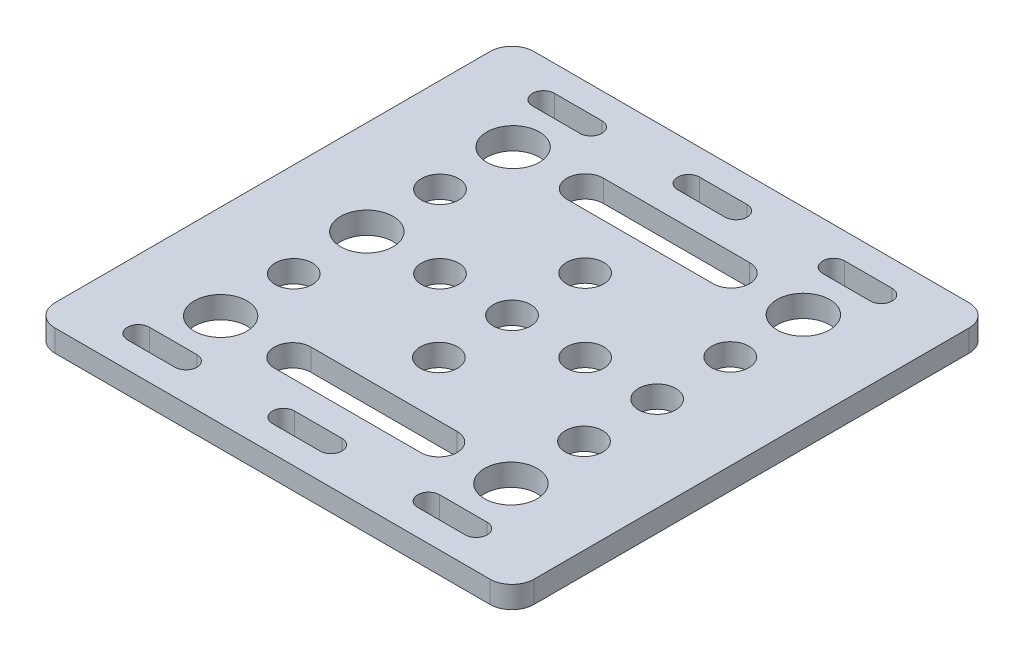
from build123d import *

# Parameters (mm, degrees)
SZKIC1_R                        = 2.55
SZKIC1_R_2                      = 3.6
DODANIE_WYCI_GNI_CIE1_DEPTH     = 3
OTWORY_USTALAJ_CE_10_0MM1_D     = 7.2
OTWORY_USTALAJ_CE_10_0MM1_DEPTH = 11.5
OTWORY_USTALAJ_CE_10_0MM1_TIP   = 2.163098228


with BuildPart() as part:
    # Szkic1 → Dodanie-wyciągnięcie1 (new body)
    with BuildSketch(Plane(origin=(0, 0, 0), x_dir=(1, 0, 0), z_dir=(0, 1, 0))):
        with BuildLine():
            ThreePointArc((0, 3), (0.878679656, 0.878679656), (3, 0))
            Line((3, 0), (62.5, 0))
            ThreePointArc((62.5, 0), (64.621320344, 0.878679656), (65.5, 3))
            Line((65.5, 3), (65.5, 62.5))
            ThreePointArc((65.5, 62.5), (64.621320344, 64.621320344), (62.5, 65.5))
            Line((62.5, 65.5), (3, 65.5))
            ThreePointArc((3, 65.5), (0.878679656, 64.621320344), (0, 62.5))
            Line((0, 62.5), (0, 3))
        make_face()
        with BuildLine():
            Line((15.85, 3.55), (9.35, 3.55))
            ThreePointArc((9.35, 3.55), (7.85, 5.05), (9.35, 6.55))
            Line((9.35, 6.55), (15.85, 6.55))
            ThreePointArc((15.85, 6.55), (17.35, 5.05), (15.85, 3.55))
        make_face(mode=Mode.SUBTRACT)
        with BuildLine():
            Line((35.7, 3.55), (29.2, 3.55))
            ThreePointArc((29.2, 3.55), (27.7, 5.05), (29.2, 6.55))
            Line((29.2, 6.55), (35.7, 6.55))
            ThreePointArc((35.7, 6.55), (37.2, 5.05), (35.7, 3.55))
        make_face(mode=Mode.SUBTRACT)
        with Locations((12.9, 22.75)):
            Circle(SZKIC1_R, mode=Mode.SUBTRACT)
        with Locations((22.9, 32.75)):
            Circle(SZKIC1_R, mode=Mode.SUBTRACT)
        with BuildLine():
            ThreePointArc((22.75, 10.25), (20.25, 12.75), (22.75, 15.25))
            Line((22.75, 15.25), (42.75, 15.25))
            ThreePointArc((42.75, 15.25), (45.25, 12.75), (42.75, 10.25))
            Line((42.75, 10.25), (22.75, 10.25))
        make_face(mode=Mode.SUBTRACT)
        with BuildLine():
            Line((55.55, 3.55), (49.05, 3.55))
            ThreePointArc((49.05, 3.55), (47.55, 5.05), (49.05, 6.55))
            Line((49.05, 6.55), (55.55, 6.55))
            ThreePointArc((55.55, 6.55), (57.05, 5.05), (55.55, 3.55))
        make_face(mode=Mode.SUBTRACT)
        with Locations((32.75, 22.75)):
            Circle(SZKIC1_R, mode=Mode.SUBTRACT)
        with Locations((42.75, 32.75)):
            Circle(SZKIC1_R, mode=Mode.SUBTRACT)
        with Locations((52.6, 22.75)):
            Circle(SZKIC1_R, mode=Mode.SUBTRACT)
        with Locations((12.9, 32.75)):
            Circle(SZKIC1_R_2, mode=Mode.SUBTRACT)
        with Locations((12.9, 42.75)):
            Circle(SZKIC1_R, mode=Mode.SUBTRACT)
        with BuildLine():
            ThreePointArc((9.35, 58.95), (7.85, 60.45), (9.35, 61.95))
            Line((9.35, 61.95), (15.85, 61.95))
            ThreePointArc((15.85, 61.95), (17.35, 60.45), (15.85, 58.95))
            Line((15.85, 58.95), (9.35, 58.95))
        make_face(mode=Mode.SUBTRACT)
        with BuildLine():
            Line((42.75, 50.25), (22.75, 50.25))
            ThreePointArc((22.75, 50.25), (20.25, 52.75), (22.75, 55.25))
            Line((22.75, 55.25), (42.75, 55.25))
            ThreePointArc((42.75, 55.25), (45.25, 52.75), (42.75, 50.25))
        make_face(mode=Mode.SUBTRACT)
        with BuildLine():
            Line((35.7, 58.95), (29.2, 58.95))
            ThreePointArc((29.2, 58.95), (27.7, 60.45), (29.2, 61.95))
            Line((29.2, 61.95), (35.7, 61.95))
            ThreePointArc((35.7, 61.95), (37.2, 60.45), (35.7, 58.95))
        make_face(mode=Mode.SUBTRACT)
        with Locations((32.75, 32.75)):
            Circle(SZKIC1_R, mode=Mode.SUBTRACT)
        with Locations((32.75, 42.75)):
            Circle(SZKIC1_R, mode=Mode.SUBTRACT)
        with Locations((52.6, 32.75)):
            Circle(SZKIC1_R, mode=Mode.SUBTRACT)
        with Locations((52.6, 42.75)):
            Circle(SZKIC1_R, mode=Mode.SUBTRACT)
        with BuildLine():
            Line((55.55, 58.95), (49.05, 58.95))
            ThreePointArc((49.05, 58.95), (47.55, 60.45), (49.05, 61.95))
            Line((49.05, 61.95), (55.55, 61.95))
            ThreePointArc((55.55, 61.95), (57.05, 60.45), (55.55, 58.95))
        make_face(mode=Mode.SUBTRACT)
    extrude(amount=DODANIE_WYCI_GNI_CIE1_DEPTH)

    # Otwory ustalające Ø10.0mm1
    with Locations(Plane(origin=(0, 3, 0), x_dir=(1, 0, 0), z_dir=(0, 1, 0))):
        with Locations((12.9, 12.75), (12.9, 52.75), (52.6, 12.75), (52.6, 52.75)):
            Hole(OTWORY_USTALAJ_CE_10_0MM1_D / 2, depth=OTWORY_USTALAJ_CE_10_0MM1_DEPTH)
            with Locations((0, 0, -(OTWORY_USTALAJ_CE_10_0MM1_DEPTH + OTWORY_USTALAJ_CE_10_0MM1_TIP / 2))):  # 118° drill point
                Cone(0, OTWORY_USTALAJ_CE_10_0MM1_D / 2, OTWORY_USTALAJ_CE_10_0MM1_TIP, mode=Mode.SUBTRACT)


solid = part.part
